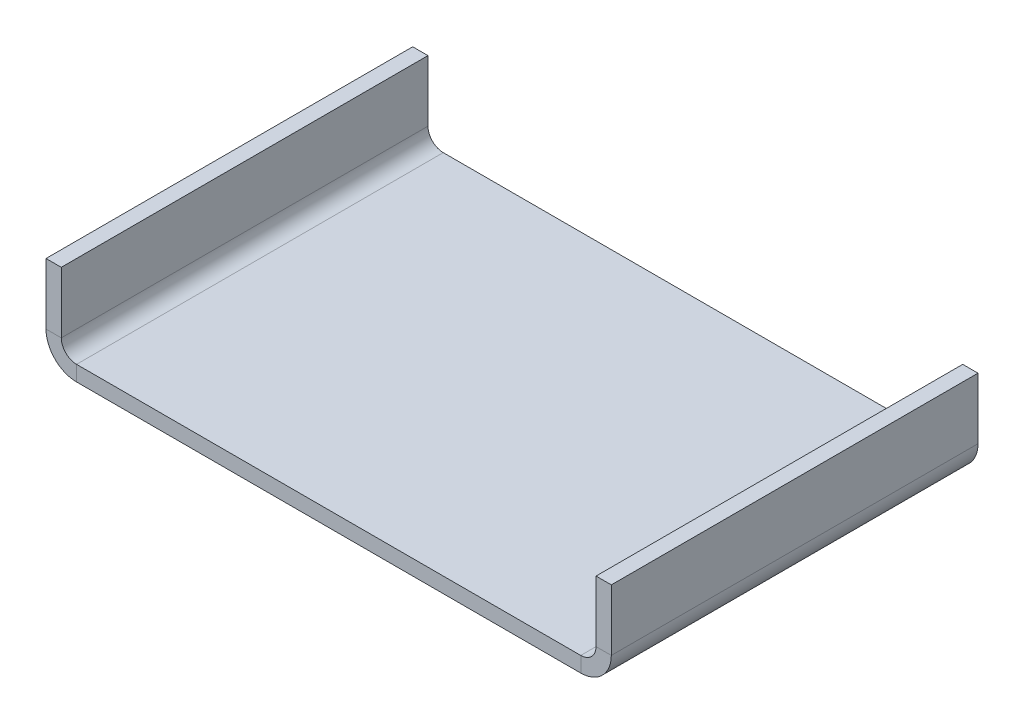
from build123d import *

# Parameters (mm, degrees)
BASE_FLANGE1_DEPTH = 76.2


# Sheet-metal steps are written as plain solids
with BuildPart() as part:
    # Sketch1 → Base-Flange1 (new body)
    with BuildSketch(Plane.XY):
        with BuildLine():
            Line((117.475, 19.05), (117.475, 6.35))
            ThreePointArc((117.475, 6.35), (115.615128061, 1.859871939), (111.125, 0))
            Line((111.125, 0), (6.35, 0))
            ThreePointArc((6.35, 0), (1.859871939, 1.859871939), (0, 6.35))
            Line((0, 6.35), (0, 19.05))
            Line((0, 19.05), (3.175, 19.05))
            Line((3.175, 19.05), (3.175, 6.35))
            ThreePointArc((3.175, 6.35), (4.10493597, 4.10493597), (6.35, 3.175))
            Line((6.35, 3.175), (111.125, 3.175))
            ThreePointArc((111.125, 3.175), (113.37006403, 4.10493597), (114.3, 6.35))
            Line((114.3, 6.35), (114.3, 19.05))
            Line((114.3, 19.05), (117.475, 19.05))
        make_face()
    extrude(amount=BASE_FLANGE1_DEPTH)


solid = part.part
